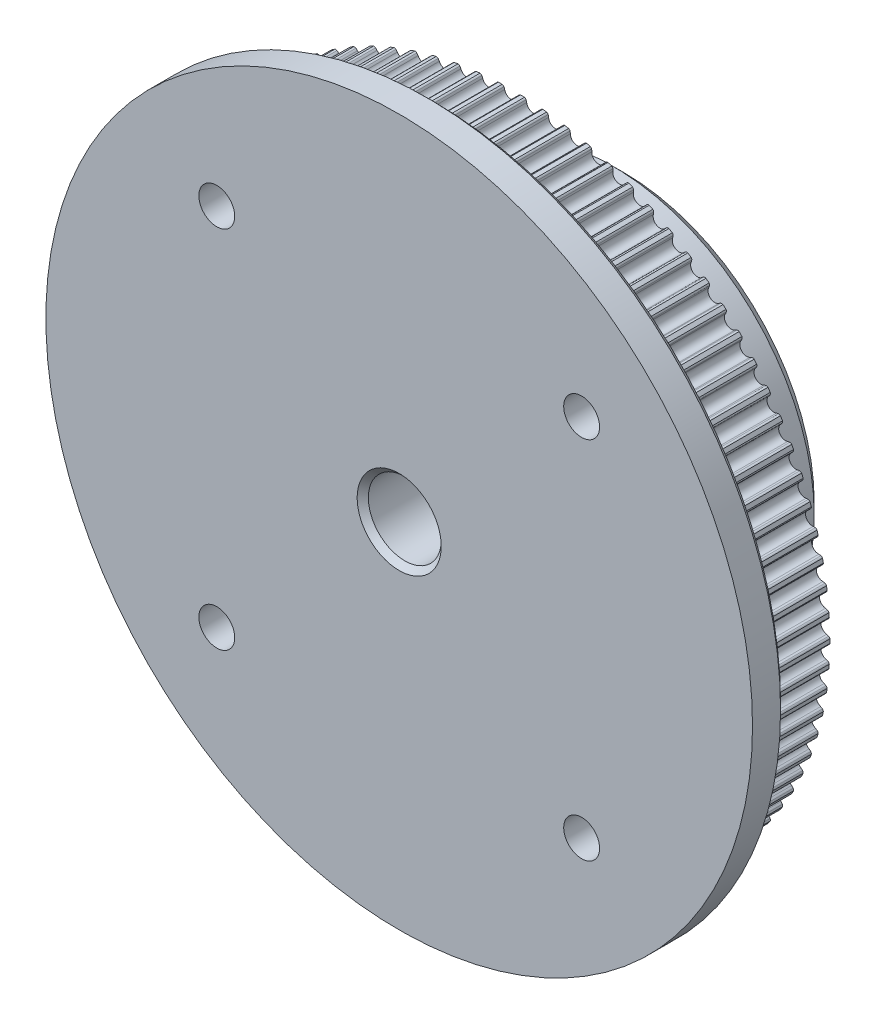
from build123d import *

# Parameters (mm, degrees)
SKETCH_13_R              = 18
EXTRUDE_1_DEPTH          = 10
CHAMFER_1_SIZE           = 1
CHAMFER_2_SIZE           = 1
SKETCH_14_R              = 3.25
CUT_EXTRUDE_4_DEPTH      = 49.831342394
CHAMFER_5_SIZE           = 0.5
CHAMFER_6_SIZE           = 0.5
CUT_EXTRUDE_5_REACH      = 63.988
CUT_EXTRUDE_5_END_RADIUS = 3.25
SKETCH_16_R              = 1.2
SKETCH_17_R              = 1.2
CUT_EXTRUDE_6_DEPTH      = 46.656324863
CUT_EXTRUDE1_START       = -7
CUT_EXTRUDE1_OUTLINE_R   = 29
CUT_EXTRUDE1_DEPTH       = 7
CIRPATTERN1_COUNT        = 4
CHAMFER1_SIZE            = 0.5
SKETCH7_R                = 1.6
CUT_EXTRUDE2_DEPTH       = 46.656324863


# Read off the part's stored shape, not the designer's step: Cut-Extrude1
with BuildPart() as part:
    # Эскиз2 → Повернуть1 (revolve)
    with BuildSketch(Plane(origin=(0, 0, 0), x_dir=(0, 0, -1), z_dir=(1, 0, 0)), mode=Mode.PRIVATE) as revolve_1_sk:
        Polygon((0, 0), (0, 31.5), (3, 31.5), (3, 29), (10, 29), (10, 0), align=None)
    revolve(revolve_1_sk.sketch.rotate(Axis((0, 0, 0), (0, 0, -1)), 90), axis=Axis((0, 0, 0), (0, 0, -1)))

    # Эскиз13 → Бобышка-Вытянуть1 (add)
    with BuildSketch(Plane(origin=(0, 0, -10), x_dir=(-1, 0, 0), z_dir=(0, 0, -1))):
        with Locations(Location((0, 0, 0), (0, 0, 180))):
            Circle(SKETCH_13_R)
    extrude(amount=EXTRUDE_1_DEPTH)

    # Фаска1
    chamfer_1_edges = [part.edges().sort_by_distance(p)[0] for p in [
        (-18, 0, -10),
    ]]
    chamfer(chamfer_1_edges, length=CHAMFER_1_SIZE)

    # Фаска2
    chamfer_2_edges = [part.edges().sort_by_distance(p)[0] for p in [
        (-18, 0, -20),
    ]]
    chamfer(chamfer_2_edges, length=CHAMFER_2_SIZE)

    # Эскиз14 → Вырез-Вытянуть4 (cut, through all)
    with BuildSketch(Plane(origin=(0, 0, -20), x_dir=(-1, 0, 0), z_dir=(0, 0, -1))):
        Circle(SKETCH_14_R)
    extrude(amount=-CUT_EXTRUDE_4_DEPTH, mode=Mode.SUBTRACT)

    # Фаска5
    chamfer_5_edges = [part.edges().sort_by_distance(p)[0] for p in [
        (3.25, 0, 0),
    ]]
    chamfer(chamfer_5_edges, length=CHAMFER_5_SIZE)

    # Фаска6
    chamfer_6_edges = [part.edges().sort_by_distance(p)[0] for p in [
        (3.25, 0, -20),
    ]]
    chamfer(chamfer_6_edges, length=CHAMFER_6_SIZE)

    # Вырез-Вытянуть5: up to this cylinder (the profile starts outside it)
    cut_extrude_5_end = Plane(origin=(0, 0, -16.5), z_dir=(0, 0, -1)) * Cylinder(CUT_EXTRUDE_5_END_RADIUS, 135.476, mode=Mode.PRIVATE)
    # Эскиз16 → Вырез-Вытянуть5 (cut, up to the surface)
    with BuildSketch(Plane(origin=(0, 18, 0), x_dir=(1, 0, 0), z_dir=(0, 1, 0)), mode=Mode.PRIVATE) as cut_extrude_5_sk1:
        with Locations(Location((0, 16.5, 0), (0, 0, 270))):
            Circle(SKETCH_16_R)
    cut_extrude_5_tool1 = extrude(cut_extrude_5_sk1.sketch, amount=-CUT_EXTRUDE_5_REACH, mode=Mode.PRIVATE) - cut_extrude_5_end
    cut_extrude_5 = cut_extrude_5_tool1.solids().sort_by_distance((0, 18, -16.5))[0]
    add(cut_extrude_5, mode=Mode.SUBTRACT)

    # Эскиз17 → Вырез-Вытянуть6 (cut, through all)
    with BuildSketch(Plane(origin=(0, 0, -10), x_dir=(-1, 0, 0), z_dir=(0, 0, -1))):
        with Locations((-16.263455967, 16.263455967)):
            Circle(SKETCH_17_R)
        with Locations((16.263455967, 16.263455967)):
            Circle(SKETCH_17_R)
        with Locations((16.263455967, -16.263455967)):
            Circle(SKETCH_17_R)
        with Locations((-16.263455967, -16.263455967)):
            Circle(SKETCH_17_R)
    extrude(amount=-CUT_EXTRUDE_6_DEPTH, mode=Mode.SUBTRACT)

    # Cut-Extrude1 outline → Cut-Extrude1 (cut)
    with BuildSketch(Plane(origin=(0, 0, -10), x_dir=(-1, 0, 0), z_dir=(0, 0, -1)).offset(CUT_EXTRUDE1_START)):
        Circle(CUT_EXTRUDE1_OUTLINE_R)
        with BuildLine():
            ThreePointArc((0.663199906, 28.275365059), (0.726070477, 28.347977503), (0.813219602, 28.388354547))
            ThreePointArc((0.813219602, 28.388354547), (0.991145706, 28.382699487), (1.169032869, 28.375929274))
            ThreePointArc((1.169032869, 28.375929274), (1.253153143, 28.329571371), (1.310805376, 28.252750177))
            ThreePointArc((1.310805376, 28.252750177), (1.344672476, 28.162535167), (1.365050368, 28.068351995))
            ThreePointArc((1.365050368, 28.068351995), (1.926157607, 27.545337094), (2.554593795, 27.985171015))
            ThreePointArc((2.554593795, 27.985171015), (2.587881134, 28.075601549), (2.633974144, 28.160225204))
            ThreePointArc((2.633974144, 28.160225204), (2.701756753, 28.228275139), (2.791510149, 28.26247461))
            ThreePointArc((2.791510149, 28.26247461), (2.968608357, 28.244421828), (3.145589929, 28.225259326))
            ThreePointArc((3.145589929, 28.225259326), (3.226271527, 28.173146415), (3.278424546, 28.092490737))
            ThreePointArc((3.278424546, 28.092490737), (3.305916067, 28.000133037), (3.319674433, 27.9047578))
            ThreePointArc((3.319674433, 27.9047578), (3.842931168, 27.343876075), (4.50051778, 27.73880109))
            ThreePointArc((4.50051778, 27.73880109), (4.540032148, 27.826689333), (4.591915926, 27.907891562))
            ThreePointArc((4.591915926, 27.907891562), (4.664280343, 27.971047455), (4.756200738, 27.998902738))
            ThreePointArc((4.756200738, 27.998902738), (4.931608246, 27.968540186), (5.106821991, 27.937078751))
            ThreePointArc((5.106821991, 27.937078751), (5.18367184, 27.879464721), (5.230071561, 27.795367506))
            ThreePointArc((5.230071561, 27.795367506), (5.251053567, 27.701317073), (5.258125377, 27.60521443))
            ThreePointArc((5.258125377, 27.60521443), (5.740982353, 27.00919844), (6.424515694, 27.357290514))
            ThreePointArc((6.424515694, 27.357290514), (6.470064581, 27.442208283), (6.527486354, 27.519593478))
            ThreePointArc((6.527486354, 27.519593478), (6.604080028, 27.57754764), (6.697719596, 27.598923026))
            ThreePointArc((6.697719596, 27.598923026), (6.870581835, 27.556398626), (7.043174129, 27.512791537))
            ThreePointArc((7.043174129, 27.512791537), (7.115817825, 27.449957078), (7.156238193, 27.362828038))
            ThreePointArc((7.156238193, 27.362828038), (7.170608461, 27.267543076), (7.170959264, 27.17118123))
            ThreePointArc((7.170959264, 27.17118123), (7.611064051, 26.542934705), (8.317214015, 26.842497969))
            ThreePointArc((8.317214015, 26.842497969), (8.368575511, 26.924031553), (8.431255526, 26.997222701))
            ThreePointArc((8.431255526, 26.997222701), (8.511705299, 27.049692785), (8.606607837, 27.064484136))
            ThreePointArc((8.606607837, 27.064484136), (8.77608264, 27.010005063), (8.945212632, 26.954464769))
            ThreePointArc((8.945212632, 26.954464769), (9.01329626, 26.886716003), (9.047540352, 26.796979622))
            ThreePointArc((9.047540352, 26.796979622), (9.055228872, 26.700924351), (9.048856957, 26.604772767))
            ThreePointArc((9.048856957, 26.604772767), (9.444065409, 25.947356461), (10.169391704, 26.196931472))
            ThreePointArc((10.169391704, 26.196931472), (10.226315582, 26.274683647), (10.293948468, 26.343324169))
            ThreePointArc((10.293948468, 26.343324169), (10.377862398, 26.390054546), (10.47356555, 26.398189799))
            ThreePointArc((10.47356555, 26.398189799), (10.638827253, 26.33202147), (10.803670957, 26.264818557))
            ThreePointArc((10.803670957, 26.264818557), (10.866862822, 26.19248555), (10.894763804, 26.100579016))
            ThreePointArc((10.894763804, 26.100579016), (10.895733118, 26.004221407), (10.88266953, 25.908748525))
            ThreePointArc((10.88266953, 25.908748525), (11.23105623, 25.225365304), (11.972025139, 25.423736159))
            ThreePointArc((11.972025139, 25.423736159), (12.034234071, 25.497328124), (12.106490327, 25.561083609))
            ThreePointArc((12.106490327, 25.561083609), (12.193459593, 25.601846614), (12.289497104, 25.603286135))
            ThreePointArc((12.289497104, 25.603286135), (12.449740569, 25.525750915), (12.609494884, 25.44721279))
            ThreePointArc((12.609494884, 25.44721279), (12.667487121, 25.37064794), (12.688909062, 25.277019012))
            ThreePointArc((12.688909062, 25.277019012), (12.683154447, 25.180828509), (12.66346283, 25.086499464))
            ThreePointArc((12.66346283, 25.086499464), (12.963330475, 24.380478703), (13.716332072, 24.526678958))
            ThreePointArc((13.716332072, 24.526678958), (13.783522981, 24.595752181), (13.860050583, 24.654312019))
            ThreePointArc((13.860050583, 24.654312019), (13.94965148, 24.688909058), (14.045555464, 24.683645835))
            ThreePointArc((14.045555464, 24.683645835), (14.2, 24.595121467), (14.353886619, 24.50563076))
            ThreePointArc((14.353886619, 24.50563076), (14.406396696, 24.425207084), (14.42123523, 24.330311912))
            ThreePointArc((14.42123523, 24.330311912), (14.408784723, 24.234757146), (14.382561012, 24.1420315))
            ThreePointArc((14.382561012, 24.1420315), (14.632448676, 23.41681286), (15.393814413, 23.510130242))
            ThreePointArc((15.393814413, 23.510130242), (15.465659953, 23.574348206), (15.546086065, 23.6274271))
            ThreePointArc((15.546086065, 23.6274271), (15.637882066, 23.655689619), (15.73318529, 23.643749293))
            ThreePointArc((15.73318529, 23.643749293), (15.881078459, 23.544667061), (16.028347661, 23.44465976))
            ThreePointArc((16.028347661, 23.44465976), (16.075119755, 23.360769075), (16.08330259, 23.265069978))
            ThreePointArc((16.08330259, 23.265069978), (16.064216848, 23.170616482), (16.031588803, 23.079945985))
            ThreePointArc((16.031588803, 23.079945985), (16.230279057, 22.339062659), (16.996299638, 22.379042536))
            ThreePointArc((16.996299638, 22.379042536), (17.072449785, 22.438092376), (17.156382579, 22.485431731))
            ThreePointArc((17.156382579, 22.485431731), (17.249926463, 22.507222038), (17.344164618, 22.488662782))
            ThreePointArc((17.344164618, 22.488662782), (17.484785899, 22.379505402), (17.624720205, 22.269468734))
            ThreePointArc((17.624720205, 22.269468734), (17.665526445, 22.182519746), (17.667013716, 22.086482962))
            ThreePointArc((17.667013716, 22.086482962), (17.641385724, 21.993590904), (17.602512304, 21.905417293))
            ThreePointArc((17.602512304, 21.905417293), (17.749037151, 21.15247879), (18.515980599, 21.138926384))
            ThreePointArc((18.515980599, 21.138926384), (18.596064357, 21.192520416), (18.683094922, 21.233889598))
            ThreePointArc((18.683094922, 21.233889598), (18.777930953, 21.249101534), (18.870644919, 21.224013766))
            ThreePointArc((18.870644919, 21.224013766), (19.003309221, 21.105313044), (19.135226883, 20.985783095))
            ThreePointArc((19.135226883, 20.985783095), (19.169868467, 20.896199411), (19.164652928, 20.800292822))
            ThreePointArc((19.164652928, 20.800292822), (19.132607541, 20.709414762), (19.087678135, 20.62416761))
            ThreePointArc((19.087678135, 20.62416761), (19.18132372, 19.862842171), (19.945453564, 19.795823507))
            ThreePointArc((19.945453564, 19.795823507), (20.029080772, 19.843700626), (20.118785104, 19.87889809))
            ThreePointArc((20.118785104, 19.87889809), (20.21445125, 19.887457544), (20.305189336, 19.855963488))
            ThreePointArc((20.305189336, 19.855963488), (20.42925033, 19.728297721), (20.55250866, 19.599856831))
            ThreePointArc((20.55250866, 19.599856831), (20.580816816, 19.508074893), (20.568923877, 19.412765745))
            ThreePointArc((20.568923877, 19.412765745), (20.530617218, 19.324344433), (20.479850717, 19.242439056))
            ThreePointArc((20.479850717, 19.242439056), (20.520160808, 18.476435781), (21.277754285, 18.356277368))
            ThreePointArc((21.277754285, 18.356277368), (21.36451752, 18.398204322), (21.456458587, 18.427058588))
            ThreePointArc((21.456458587, 18.427058588), (21.552488773, 18.428923859), (21.640808911, 18.391176952))
            ThreePointArc((21.640808911, 18.391176952), (21.755662185, 18.255168115), (21.86966068, 18.118442034))
            ThreePointArc((21.86966068, 18.118442034), (21.891497495, 18.024908996), (21.872985096, 17.930661625))
            ThreePointArc((21.872985096, 17.930661625), (21.828603791, 17.84512784), (21.772247525, 17.766963272))
            ThreePointArc((21.772247525, 17.766963272), (21.759025735, 17.000014053), (22.506391925, 16.827301291))
            ThreePointArc((22.506391925, 16.827301291), (22.595868486, 16.863073815), (22.689598361, 16.88544431))
            ThreePointArc((22.689598361, 16.88544431), (22.785524736, 16.880606309), (22.87099664, 16.836790451))
            ThreePointArc((22.87099664, 16.836790451), (22.97608264, 16.693101165), (23.080265912, 16.548756009))
            ThreePointArc((23.080265912, 16.548756009), (23.095524999, 16.453927553), (23.07048333, 16.361201124))
            ThreePointArc((23.07048333, 16.361201124), (23.020243601, 16.278971579), (22.958572131, 16.20492863))
            ThreePointArc((22.958572131, 16.20492863), (22.891882876, 15.440769966), (23.625380686, 15.216344293))
            ThreePointArc((23.625380686, 15.216344293), (23.717134652, 15.245788108), (23.812196692, 15.261565844))
            ThreePointArc((23.812196692, 15.261565844), (23.907551914, 15.250048143), (23.989759173, 15.200376799))
            ThreePointArc((23.989759173, 15.200376799), (24.084565931, 15.049707104), (24.178426408, 14.898446108))
            ThreePointArc((24.178426408, 14.898446108), (24.187033426, 14.802784229), (24.155584489, 14.712030495))
            ThreePointArc((24.155584489, 14.712030495), (24.099731098, 14.633505804), (24.033044882, 14.563945204))
            ThreePointArc((24.033044882, 14.563945204), (23.913213065, 13.8063), (24.629268967, 13.531254796))
            ThreePointArc((24.629268967, 13.531254796), (24.722853322, 13.554226454), (24.818784395, 13.563334563))
            ThreePointArc((24.818784395, 13.563334563), (24.913103902, 13.545193274), (24.99164601, 13.489908439))
            ThreePointArc((24.99164601, 13.489908439), (25.075711637, 13.332992383), (25.158792041, 13.175552475))
            ThreePointArc((25.158792041, 13.175552475), (25.160705057, 13.079523228), (25.123002068, 12.991184333))
            ThreePointArc((25.123002068, 12.991184333), (25.061807128, 12.916747059), (24.990431054, 12.852007701))
            ThreePointArc((24.990431054, 12.852007701), (24.818040483, 12.104567128), (25.513165926, 11.780242385))
            ThreePointArc((25.513165926, 11.780242385), (25.608124735, 11.796629971), (25.704457475, 11.79902408))
            ThreePointArc((25.704457475, 11.79902408), (25.797281752, 11.774347586), (25.87177606, 11.713718602))
            ThreePointArc((25.87177606, 11.713718602), (25.944690997, 11.551320664), (26.016586569, 11.388468875))
            ThreePointArc((26.016586569, 11.388468875), (26.011796263, 11.292540106), (25.968022907, 11.207046427))
            ThreePointArc((25.968022907, 11.207046427), (25.901784553, 11.137059222), (25.826066357, 11.077456509))
            ThreePointArc((25.826066357, 11.077456509), (25.601956903, 10.343862022), (26.272765304, 9.971837818))
            ThreePointArc((26.272765304, 9.971837818), (26.368635939, 9.981561492), (26.464901022, 9.977229937))
            ThreePointArc((26.464901022, 9.977229937), (26.555777838, 9.94613846), (26.625861418, 9.880460704))
            ThreePointArc((26.625861418, 9.880460704), (26.68727043, 9.71337207), (26.747630902, 9.545901799))
            ThreePointArc((26.747630902, 9.545901799), (26.736160612, 9.450540862), (26.686530148, 9.368308917))
            ThreePointArc((26.686530148, 9.368308917), (26.615571087, 9.303112751), (26.535879662, 9.248937062))
            ThreePointArc((26.535879662, 9.248937062), (26.261143162, 8.532762659), (26.904366411, 8.114851459))
            ThreePointArc((26.904366411, 8.114851459), (27.000681799, 8.11786385), (27.096410231, 8.106827733))
            ThreePointArc((27.096410231, 8.106827733), (27.184896845, 8.069472747), (27.250228256, 7.999066196))
            ThreePointArc((27.250228256, 7.999066196), (27.299832165, 7.828100905), (27.348363465, 7.656828049))
            ThreePointArc((27.348363465, 7.656828049), (27.330269074, 7.562499534), (27.275023297, 7.483929948))
            ThreePointArc((27.275023297, 7.483929948), (27.199689233, 7.42384245), (27.116412828, 7.375357723))
            ThreePointArc((27.116412828, 7.375357723), (26.792387771, 6.680092534), (27.40489215, 6.218330359))
            ThreePointArc((27.40489215, 6.218330359), (27.501183053, 6.21461679), (27.595908454, 6.196929879))
            ThreePointArc((27.595908454, 6.196929879), (27.681573766, 6.153493374), (27.74183472, 6.078701041))
            ThreePointArc((27.74183472, 6.078701041), (27.779391861, 5.90469202), (27.815857551, 5.730451003))
            ThreePointArc((27.815857551, 5.730451003), (27.791227213, 5.637614468), (27.730635274, 5.563090024))
            ThreePointArc((27.730635274, 5.563090024), (27.651293229, 5.508403935), (27.564837557, 5.465846383))
            ThreePointArc((27.564837557, 5.465846383), (27.193102561, 4.794877671), (27.771904008, 4.291514179))
            ThreePointArc((27.771904008, 4.291514179), (27.867701305, 4.281092743), (27.960962184, 4.256841206))
            ThreePointArc((27.960962184, 4.256841206), (28.043388843, 4.2075348), (28.098285755, 4.128721065))
            ThreePointArc((28.098285755, 4.128721065), (28.123613152, 3.952516067), (28.147835575, 3.776155775))
            ThreePointArc((28.147835575, 3.776155775), (28.116789286, 3.685263511), (28.051146383, 3.615147285))
            ThreePointArc((28.051146383, 3.615147285), (27.968182902, 3.56612903), (27.878969167, 3.529705989))
            ThreePointArc((27.878969167, 3.529705989), (27.461335288, 2.886302645), (28.003613942, 2.343790174))
            ThreePointArc((28.003613942, 2.343790174), (28.098450919, 2.326711642), (28.189792917, 2.296013631))
            ThreePointArc((28.189792917, 2.296013631), (28.268579348, 2.241077539), (28.317844766, 2.158626376))
            ThreePointArc((28.317844766, 2.158626376), (28.330819027, 1.981083854), (28.342680173, 1.803463496))
            ThreePointArc((28.342680173, 1.803463496), (28.305369187, 1.714958321), (28.234995127, 1.649591912))
            ThreePointArc((28.234995127, 1.649591912), (28.148814401, 1.606480303), (28.057277243, 1.576369222))
            ThreePointArc((28.057277243, 1.576369222), (27.59577915, 0.963665843), (28.098893084, 0.384647458))
            ThreePointArc((28.098893084, 0.384647458), (28.192307705, 0.360995035), (28.281285813, 0.324000107))
            ThreePointArc((28.281285813, 0.324000107), (28.356048176, 0.263701974), (28.399442083, 0.178015075))
            ThreePointArc((28.399442083, 0.178015075), (28.4, 0), (28.399442083, -0.178015075))
            ThreePointArc((28.399442083, -0.178015075), (28.356048176, -0.263701974), (28.281285813, -0.324000107))
            ThreePointArc((28.281285813, -0.324000107), (28.192307705, -0.360995035), (28.098893084, -0.384647458))
            ThreePointArc((28.098893084, -0.384647458), (27.59577915, -0.963665843), (28.057277243, -1.576369222))
            ThreePointArc((28.057277243, -1.576369222), (28.148814401, -1.606480303), (28.234995127, -1.649591912))
            ThreePointArc((28.234995127, -1.649591912), (28.305369187, -1.714958321), (28.342680173, -1.803463497))
            ThreePointArc((28.342680173, -1.803463497), (28.330819027, -1.981083855), (28.317844766, -2.158626376))
            ThreePointArc((28.317844766, -2.158626376), (28.268579348, -2.241077539), (28.189792917, -2.296013631))
            ThreePointArc((28.189792917, -2.296013631), (28.098450919, -2.326711642), (28.003613942, -2.343790174))
            ThreePointArc((28.003613942, -2.343790174), (27.461335288, -2.886302645), (27.878969167, -3.529705989))
            ThreePointArc((27.878969167, -3.529705989), (27.968182902, -3.56612903), (28.051146383, -3.615147285))
            ThreePointArc((28.051146383, -3.615147285), (28.116789286, -3.685263511), (28.147835575, -3.776155775))
            ThreePointArc((28.147835575, -3.776155775), (28.123613152, -3.952516067), (28.098285755, -4.128721065))
            ThreePointArc((28.098285755, -4.128721065), (28.043388843, -4.2075348), (27.960962184, -4.256841206))
            ThreePointArc((27.960962184, -4.256841206), (27.867701305, -4.281092743), (27.771904008, -4.291514179))
            ThreePointArc((27.771904008, -4.291514179), (27.193102561, -4.794877671), (27.564837557, -5.465846383))
            ThreePointArc((27.564837557, -5.465846383), (27.651293229, -5.508403935), (27.730635274, -5.563090024))
            ThreePointArc((27.730635274, -5.563090024), (27.791227213, -5.637614468), (27.815857551, -5.730451003))
            ThreePointArc((27.815857551, -5.730451003), (27.779391861, -5.90469202), (27.74183472, -6.078701041))
            ThreePointArc((27.74183472, -6.078701041), (27.681573766, -6.153493374), (27.595908454, -6.196929879))
            ThreePointArc((27.595908454, -6.196929879), (27.501183053, -6.21461679), (27.40489215, -6.218330359))
            ThreePointArc((27.40489215, -6.218330359), (26.792387771, -6.680092534), (27.116412828, -7.375357723))
            ThreePointArc((27.116412828, -7.375357723), (27.199689233, -7.42384245), (27.275023297, -7.483929948))
            ThreePointArc((27.275023297, -7.483929948), (27.330269074, -7.562499534), (27.348363465, -7.656828049))
            ThreePointArc((27.348363465, -7.656828049), (27.299832165, -7.828100905), (27.250228256, -7.999066196))
            ThreePointArc((27.250228256, -7.999066196), (27.184896845, -8.069472747), (27.096410231, -8.106827733))
            ThreePointArc((27.096410231, -8.106827733), (27.000681799, -8.11786385), (26.904366411, -8.114851459))
            ThreePointArc((26.904366411, -8.114851459), (26.261143162, -8.532762659), (26.535879662, -9.248937062))
            ThreePointArc((26.535879662, -9.248937062), (26.615571087, -9.303112751), (26.686530148, -9.368308917))
            ThreePointArc((26.686530148, -9.368308917), (26.736160612, -9.450540862), (26.747630902, -9.545901799))
            ThreePointArc((26.747630902, -9.545901799), (26.68727043, -9.71337207), (26.625861418, -9.880460704))
            ThreePointArc((26.625861418, -9.880460704), (26.555777838, -9.94613846), (26.464901022, -9.977229937))
            ThreePointArc((26.464901022, -9.977229937), (26.368635939, -9.981561492), (26.272765304, -9.971837818))
            ThreePointArc((26.272765304, -9.971837818), (25.601956903, -10.343862022), (25.826066357, -11.077456509))
            ThreePointArc((25.826066357, -11.077456509), (25.901784553, -11.137059222), (25.968022907, -11.207046427))
            ThreePointArc((25.968022907, -11.207046427), (26.011796263, -11.292540106), (26.016586569, -11.388468875))
            ThreePointArc((26.016586569, -11.388468875), (25.944690997, -11.551320664), (25.87177606, -11.713718602))
            ThreePointArc((25.87177606, -11.713718602), (25.797281752, -11.774347586), (25.704457475, -11.79902408))
            ThreePointArc((25.704457475, -11.79902408), (25.608124735, -11.796629971), (25.513165926, -11.780242385))
            ThreePointArc((25.513165926, -11.780242385), (24.818040483, -12.104567128), (24.990431054, -12.852007701))
            ThreePointArc((24.990431054, -12.852007701), (25.061807128, -12.916747059), (25.123002068, -12.991184333))
            ThreePointArc((25.123002068, -12.991184333), (25.160705057, -13.079523228), (25.158792041, -13.175552475))
            ThreePointArc((25.158792041, -13.175552475), (25.075711637, -13.332992383), (24.99164601, -13.489908439))
            ThreePointArc((24.99164601, -13.489908439), (24.913103902, -13.545193274), (24.818784395, -13.563334563))
            ThreePointArc((24.818784395, -13.563334563), (24.722853322, -13.554226454), (24.629268967, -13.531254796))
            ThreePointArc((24.629268967, -13.531254796), (23.913213065, -13.8063), (24.033044882, -14.563945204))
            ThreePointArc((24.033044882, -14.563945204), (24.099731098, -14.633505804), (24.155584489, -14.712030495))
            ThreePointArc((24.155584489, -14.712030495), (24.187033426, -14.802784229), (24.178426408, -14.898446108))
            ThreePointArc((24.178426408, -14.898446108), (24.084565931, -15.049707104), (23.989759173, -15.200376799))
            ThreePointArc((23.989759173, -15.200376799), (23.907551914, -15.250048143), (23.812196692, -15.261565844))
            ThreePointArc((23.812196692, -15.261565844), (23.717134652, -15.245788108), (23.625380686, -15.216344293))
            ThreePointArc((23.625380686, -15.216344293), (22.891882876, -15.440769966), (22.958572131, -16.20492863))
            ThreePointArc((22.958572131, -16.20492863), (23.020243601, -16.278971579), (23.07048333, -16.361201124))
            ThreePointArc((23.07048333, -16.361201124), (23.095524999, -16.453927553), (23.080265912, -16.548756009))
            ThreePointArc((23.080265912, -16.548756009), (22.97608264, -16.693101165), (22.87099664, -16.836790451))
            ThreePointArc((22.87099664, -16.836790451), (22.785524736, -16.880606309), (22.689598361, -16.88544431))
            ThreePointArc((22.689598361, -16.88544431), (22.595868486, -16.863073815), (22.506391925, -16.827301291))
            ThreePointArc((22.506391925, -16.827301291), (21.759025735, -17.000014053), (21.772247525, -17.766963272))
            ThreePointArc((21.772247525, -17.766963272), (21.828603791, -17.84512784), (21.872985096, -17.930661625))
            ThreePointArc((21.872985096, -17.930661625), (21.891497495, -18.024908996), (21.86966068, -18.118442034))
            ThreePointArc((21.86966068, -18.118442034), (21.755662185, -18.255168115), (21.640808911, -18.391176952))
            ThreePointArc((21.640808911, -18.391176952), (21.552488773, -18.428923859), (21.456458587, -18.427058588))
            ThreePointArc((21.456458587, -18.427058588), (21.36451752, -18.398204322), (21.277754285, -18.356277368))
            ThreePointArc((21.277754285, -18.356277368), (20.520160808, -18.476435781), (20.479850717, -19.242439056))
            ThreePointArc((20.479850717, -19.242439056), (20.530617218, -19.324344433), (20.568923877, -19.412765745))
            ThreePointArc((20.568923877, -19.412765745), (20.580816816, -19.508074893), (20.55250866, -19.599856831))
            ThreePointArc((20.55250866, -19.599856831), (20.42925033, -19.728297721), (20.305189336, -19.855963488))
            ThreePointArc((20.305189336, -19.855963488), (20.21445125, -19.887457544), (20.118785104, -19.87889809))
            ThreePointArc((20.118785104, -19.87889809), (20.029080772, -19.843700626), (19.945453564, -19.795823507))
            ThreePointArc((19.945453564, -19.795823507), (19.18132372, -19.862842171), (19.087678135, -20.62416761))
            ThreePointArc((19.087678135, -20.62416761), (19.132607541, -20.709414762), (19.164652928, -20.800292822))
            ThreePointArc((19.164652928, -20.800292822), (19.169868467, -20.896199411), (19.135226883, -20.985783095))
            ThreePointArc((19.135226883, -20.985783095), (19.003309221, -21.105313044), (18.870644919, -21.224013766))
            ThreePointArc((18.870644919, -21.224013766), (18.777930953, -21.249101534), (18.683094922, -21.233889598))
            ThreePointArc((18.683094922, -21.233889598), (18.596064357, -21.192520416), (18.515980599, -21.138926384))
            ThreePointArc((18.515980599, -21.138926384), (17.749037151, -21.15247879), (17.602512304, -21.905417293))
            ThreePointArc((17.602512304, -21.905417293), (17.641385724, -21.993590904), (17.667013716, -22.086482962))
            ThreePointArc((17.667013716, -22.086482962), (17.665526445, -22.182519746), (17.624720205, -22.269468734))
            ThreePointArc((17.624720205, -22.269468734), (17.484785899, -22.379505402), (17.344164618, -22.488662782))
            ThreePointArc((17.344164618, -22.488662782), (17.249926463, -22.507222038), (17.156382579, -22.485431731))
            ThreePointArc((17.156382579, -22.485431731), (17.072449785, -22.438092376), (16.996299638, -22.379042536))
            ThreePointArc((16.996299638, -22.379042536), (16.230279057, -22.339062659), (16.031588803, -23.079945985))
            ThreePointArc((16.031588803, -23.079945985), (16.064216848, -23.170616482), (16.08330259, -23.265069978))
            ThreePointArc((16.08330259, -23.265069978), (16.075119755, -23.360769075), (16.028347661, -23.44465976))
            ThreePointArc((16.028347661, -23.44465976), (15.881078459, -23.544667061), (15.73318529, -23.643749293))
            ThreePointArc((15.73318529, -23.643749293), (15.637882066, -23.655689619), (15.546086065, -23.6274271))
            ThreePointArc((15.546086065, -23.6274271), (15.465659953, -23.574348206), (15.393814413, -23.510130242))
            ThreePointArc((15.393814413, -23.510130242), (14.632448676, -23.41681286), (14.382561012, -24.1420315))
            ThreePointArc((14.382561012, -24.1420315), (14.408784723, -24.234757146), (14.42123523, -24.330311912))
            ThreePointArc((14.42123523, -24.330311912), (14.406396696, -24.425207084), (14.353886619, -24.50563076))
            ThreePointArc((14.353886619, -24.50563076), (14.2, -24.595121467), (14.045555464, -24.683645835))
            ThreePointArc((14.045555464, -24.683645835), (13.94965148, -24.688909058), (13.860050583, -24.654312019))
            ThreePointArc((13.860050583, -24.654312019), (13.783522981, -24.595752181), (13.716332072, -24.526678958))
            ThreePointArc((13.716332072, -24.526678958), (12.963330475, -24.380478703), (12.66346283, -25.086499464))
            ThreePointArc((12.66346283, -25.086499464), (12.683154447, -25.180828509), (12.688909062, -25.277019012))
            ThreePointArc((12.688909062, -25.277019012), (12.667487121, -25.37064794), (12.609494884, -25.44721279))
            ThreePointArc((12.609494884, -25.44721279), (12.449740569, -25.525750915), (12.289497104, -25.603286135))
            ThreePointArc((12.289497104, -25.603286135), (12.193459593, -25.601846614), (12.106490327, -25.561083609))
            ThreePointArc((12.106490327, -25.561083609), (12.034234071, -25.497328124), (11.972025139, -25.423736159))
            ThreePointArc((11.972025139, -25.423736159), (11.23105623, -25.225365304), (10.88266953, -25.908748525))
            ThreePointArc((10.88266953, -25.908748525), (10.895733118, -26.004221407), (10.894763804, -26.100579016))
            ThreePointArc((10.894763804, -26.100579016), (10.866862822, -26.19248555), (10.803670957, -26.264818557))
            ThreePointArc((10.803670957, -26.264818557), (10.638827253, -26.33202147), (10.47356555, -26.398189799))
            ThreePointArc((10.47356555, -26.398189799), (10.377862398, -26.390054546), (10.293948468, -26.343324169))
            ThreePointArc((10.293948468, -26.343324169), (10.226315582, -26.274683647), (10.169391704, -26.196931472))
            ThreePointArc((10.169391704, -26.196931472), (9.444065409, -25.947356461), (9.048856957, -26.604772767))
            ThreePointArc((9.048856957, -26.604772767), (9.055228872, -26.700924351), (9.047540352, -26.796979622))
            ThreePointArc((9.047540352, -26.796979622), (9.01329626, -26.886716003), (8.945212632, -26.954464769))
            ThreePointArc((8.945212632, -26.954464769), (8.77608264, -27.010005063), (8.606607837, -27.064484136))
            ThreePointArc((8.606607837, -27.064484136), (8.511705299, -27.049692785), (8.431255526, -26.997222701))
            ThreePointArc((8.431255526, -26.997222701), (8.368575511, -26.924031553), (8.317214015, -26.842497969))
            ThreePointArc((8.317214015, -26.842497969), (7.611064051, -26.542934705), (7.170959264, -27.17118123))
            ThreePointArc((7.170959264, -27.17118123), (7.170608461, -27.267543076), (7.156238193, -27.362828038))
            ThreePointArc((7.156238193, -27.362828038), (7.115817825, -27.449957078), (7.043174129, -27.512791537))
            ThreePointArc((7.043174129, -27.512791537), (6.870581835, -27.556398626), (6.697719596, -27.598923026))
            ThreePointArc((6.697719596, -27.598923026), (6.604080028, -27.57754764), (6.527486354, -27.519593478))
            ThreePointArc((6.527486354, -27.519593478), (6.470064581, -27.442208283), (6.424515694, -27.357290514))
            ThreePointArc((6.424515694, -27.357290514), (5.740982353, -27.00919844), (5.258125377, -27.60521443))
            ThreePointArc((5.258125377, -27.60521443), (5.251053567, -27.701317073), (5.230071561, -27.795367506))
            ThreePointArc((5.230071561, -27.795367506), (5.18367184, -27.879464721), (5.106821991, -27.937078751))
            ThreePointArc((5.106821991, -27.937078751), (4.931608246, -27.968540186), (4.756200738, -27.998902738))
            ThreePointArc((4.756200738, -27.998902738), (4.664280343, -27.971047455), (4.591915926, -27.907891562))
            ThreePointArc((4.591915926, -27.907891562), (4.540032148, -27.826689333), (4.50051778, -27.73880109))
            ThreePointArc((4.50051778, -27.73880109), (3.842931168, -27.343876075), (3.319674433, -27.9047578))
            ThreePointArc((3.319674433, -27.9047578), (3.305916067, -28.000133037), (3.278424546, -28.092490737))
            ThreePointArc((3.278424546, -28.092490737), (3.226271527, -28.173146415), (3.145589929, -28.225259326))
            ThreePointArc((3.145589929, -28.225259326), (2.968608357, -28.244421828), (2.791510149, -28.26247461))
            ThreePointArc((2.791510149, -28.26247461), (2.701756753, -28.228275139), (2.633974144, -28.160225204))
            ThreePointArc((2.633974144, -28.160225204), (2.587881134, -28.075601549), (2.554593795, -27.985171015))
            ThreePointArc((2.554593795, -27.985171015), (1.926157607, -27.545337094), (1.365050368, -28.068351995))
            ThreePointArc((1.365050368, -28.068351995), (1.344672476, -28.162535167), (1.310805376, -28.252750177))
            ThreePointArc((1.310805376, -28.252750177), (1.253153143, -28.329571371), (1.169032869, -28.375929274))
            ThreePointArc((1.169032869, -28.375929274), (0.991145706, -28.382699487), (0.813219602, -28.388354547))
            ThreePointArc((0.813219602, -28.388354547), (0.726070477, -28.347977503), (0.663199906, -28.275365059))
            ThreePointArc((0.663199906, -28.275365059), (0.623122223, -28.187732258), (0.596224085, -28.0952))
            ThreePointArc((0.596224085, -28.0952), (0, -27.6126), (-0.596224085, -28.0952))
            ThreePointArc((-0.596224085, -28.0952), (-0.623122223, -28.187732258), (-0.663199906, -28.275365059))
            ThreePointArc((-0.663199906, -28.275365059), (-0.726070477, -28.347977503), (-0.813219602, -28.388354547))
            ThreePointArc((-0.813219602, -28.388354547), (-0.991145706, -28.382699487), (-1.169032869, -28.375929274))
            ThreePointArc((-1.169032869, -28.375929274), (-1.253153143, -28.329571371), (-1.310805376, -28.252750177))
            ThreePointArc((-1.310805376, -28.252750177), (-1.344672476, -28.162535167), (-1.365050368, -28.068351995))
            ThreePointArc((-1.365050368, -28.068351995), (-1.926157607, -27.545337094), (-2.554593795, -27.985171015))
            ThreePointArc((-2.554593795, -27.985171015), (-2.587881134, -28.075601549), (-2.633974144, -28.160225204))
            ThreePointArc((-2.633974144, -28.160225204), (-2.701756753, -28.228275139), (-2.791510149, -28.26247461))
            ThreePointArc((-2.791510149, -28.26247461), (-2.968608357, -28.244421828), (-3.145589929, -28.225259326))
            ThreePointArc((-3.145589929, -28.225259326), (-3.226271527, -28.173146415), (-3.278424546, -28.092490737))
            ThreePointArc((-3.278424546, -28.092490737), (-3.305916067, -28.000133037), (-3.319674433, -27.9047578))
            ThreePointArc((-3.319674433, -27.9047578), (-3.842931168, -27.343876075), (-4.50051778, -27.73880109))
            ThreePointArc((-4.50051778, -27.73880109), (-4.540032148, -27.826689333), (-4.591915926, -27.907891562))
            ThreePointArc((-4.591915926, -27.907891562), (-4.664280343, -27.971047455), (-4.756200738, -27.998902738))
            ThreePointArc((-4.756200738, -27.998902738), (-4.931608246, -27.968540186), (-5.106821991, -27.937078751))
            ThreePointArc((-5.106821991, -27.937078751), (-5.18367184, -27.879464721), (-5.230071561, -27.795367506))
            ThreePointArc((-5.230071561, -27.795367506), (-5.251053567, -27.701317073), (-5.258125377, -27.60521443))
            ThreePointArc((-5.258125377, -27.60521443), (-5.740982353, -27.00919844), (-6.424515694, -27.357290514))
            ThreePointArc((-6.424515694, -27.357290514), (-6.470064581, -27.442208283), (-6.527486354, -27.519593478))
            ThreePointArc((-6.527486354, -27.519593478), (-6.604080028, -27.57754764), (-6.697719596, -27.598923026))
            ThreePointArc((-6.697719596, -27.598923026), (-6.870581835, -27.556398626), (-7.043174129, -27.512791537))
            ThreePointArc((-7.043174129, -27.512791537), (-7.115817825, -27.449957078), (-7.156238193, -27.362828038))
            ThreePointArc((-7.156238193, -27.362828038), (-7.170608461, -27.267543076), (-7.170959264, -27.17118123))
            ThreePointArc((-7.170959264, -27.17118123), (-7.611064051, -26.542934705), (-8.317214015, -26.842497969))
            ThreePointArc((-8.317214015, -26.842497969), (-8.368575511, -26.924031553), (-8.431255526, -26.997222701))
            ThreePointArc((-8.431255526, -26.997222701), (-8.511705299, -27.049692785), (-8.606607837, -27.064484136))
            ThreePointArc((-8.606607837, -27.064484136), (-8.77608264, -27.010005063), (-8.945212632, -26.954464769))
            ThreePointArc((-8.945212632, -26.954464769), (-9.01329626, -26.886716003), (-9.047540352, -26.796979622))
            ThreePointArc((-9.047540352, -26.796979622), (-9.055228872, -26.700924351), (-9.048856957, -26.604772767))
            ThreePointArc((-9.048856957, -26.604772767), (-9.444065409, -25.947356461), (-10.169391704, -26.196931472))
            ThreePointArc((-10.169391704, -26.196931472), (-10.226315582, -26.274683647), (-10.293948468, -26.343324169))
            ThreePointArc((-10.293948468, -26.343324169), (-10.377862398, -26.390054546), (-10.47356555, -26.398189799))
            ThreePointArc((-10.47356555, -26.398189799), (-10.638827253, -26.33202147), (-10.803670957, -26.264818557))
            ThreePointArc((-10.803670957, -26.264818557), (-10.866862822, -26.19248555), (-10.894763804, -26.100579016))
            ThreePointArc((-10.894763804, -26.100579016), (-10.895733118, -26.004221407), (-10.88266953, -25.908748525))
            ThreePointArc((-10.88266953, -25.908748525), (-11.23105623, -25.225365304), (-11.972025139, -25.423736159))
            ThreePointArc((-11.972025139, -25.423736159), (-12.034234071, -25.497328124), (-12.106490327, -25.561083609))
            ThreePointArc((-12.106490327, -25.561083609), (-12.193459593, -25.601846614), (-12.289497104, -25.603286135))
            ThreePointArc((-12.289497104, -25.603286135), (-12.449740569, -25.525750915), (-12.609494884, -25.44721279))
            ThreePointArc((-12.609494884, -25.44721279), (-12.667487121, -25.37064794), (-12.688909062, -25.277019012))
            ThreePointArc((-12.688909062, -25.277019012), (-12.683154447, -25.180828509), (-12.66346283, -25.086499464))
            ThreePointArc((-12.66346283, -25.086499464), (-12.963330475, -24.380478703), (-13.716332072, -24.526678958))
            ThreePointArc((-13.716332072, -24.526678958), (-13.783522981, -24.595752181), (-13.860050583, -24.654312019))
            ThreePointArc((-13.860050583, -24.654312019), (-13.94965148, -24.688909058), (-14.045555464, -24.683645835))
            ThreePointArc((-14.045555464, -24.683645835), (-14.2, -24.595121467), (-14.353886619, -24.50563076))
            ThreePointArc((-14.353886619, -24.50563076), (-14.406396696, -24.425207084), (-14.42123523, -24.330311912))
            ThreePointArc((-14.42123523, -24.330311912), (-14.408784723, -24.234757146), (-14.382561012, -24.1420315))
            ThreePointArc((-14.382561012, -24.1420315), (-14.632448676, -23.41681286), (-15.393814413, -23.510130242))
            ThreePointArc((-15.393814413, -23.510130242), (-15.465659953, -23.574348206), (-15.546086065, -23.6274271))
            ThreePointArc((-15.546086065, -23.6274271), (-15.637882066, -23.655689619), (-15.73318529, -23.643749293))
            ThreePointArc((-15.73318529, -23.643749293), (-15.881078459, -23.544667061), (-16.028347661, -23.44465976))
            ThreePointArc((-16.028347661, -23.44465976), (-16.075119755, -23.360769075), (-16.08330259, -23.265069978))
            ThreePointArc((-16.08330259, -23.265069978), (-16.064216848, -23.170616482), (-16.031588803, -23.079945985))
            ThreePointArc((-16.031588803, -23.079945985), (-16.230279057, -22.339062659), (-16.996299638, -22.379042536))
            ThreePointArc((-16.996299638, -22.379042536), (-17.072449785, -22.438092376), (-17.156382579, -22.485431731))
            ThreePointArc((-17.156382579, -22.485431731), (-17.249926463, -22.507222038), (-17.344164618, -22.488662782))
            ThreePointArc((-17.344164618, -22.488662782), (-17.484785899, -22.379505402), (-17.624720205, -22.269468734))
            ThreePointArc((-17.624720205, -22.269468734), (-17.665526445, -22.182519746), (-17.667013716, -22.086482962))
            ThreePointArc((-17.667013716, -22.086482962), (-17.641385724, -21.993590904), (-17.602512304, -21.905417293))
            ThreePointArc((-17.602512304, -21.905417293), (-17.749037151, -21.15247879), (-18.515980599, -21.138926384))
            ThreePointArc((-18.515980599, -21.138926384), (-18.596064357, -21.192520416), (-18.683094922, -21.233889598))
            ThreePointArc((-18.683094922, -21.233889598), (-18.777930953, -21.249101534), (-18.870644919, -21.224013766))
            ThreePointArc((-18.870644919, -21.224013766), (-19.003309221, -21.105313044), (-19.135226883, -20.985783095))
            ThreePointArc((-19.135226883, -20.985783095), (-19.169868467, -20.896199411), (-19.164652928, -20.800292822))
            ThreePointArc((-19.164652928, -20.800292822), (-19.132607541, -20.709414762), (-19.087678135, -20.62416761))
            ThreePointArc((-19.087678135, -20.62416761), (-19.18132372, -19.862842171), (-19.945453564, -19.795823507))
            ThreePointArc((-19.945453564, -19.795823507), (-20.029080772, -19.843700626), (-20.118785104, -19.87889809))
            ThreePointArc((-20.118785104, -19.87889809), (-20.21445125, -19.887457544), (-20.305189336, -19.855963488))
            ThreePointArc((-20.305189336, -19.855963488), (-20.42925033, -19.728297721), (-20.55250866, -19.599856831))
            ThreePointArc((-20.55250866, -19.599856831), (-20.580816816, -19.508074893), (-20.568923877, -19.412765745))
            ThreePointArc((-20.568923877, -19.412765745), (-20.530617218, -19.324344433), (-20.479850717, -19.242439056))
            ThreePointArc((-20.479850717, -19.242439056), (-20.520160808, -18.476435781), (-21.277754285, -18.356277368))
            ThreePointArc((-21.277754285, -18.356277368), (-21.36451752, -18.398204322), (-21.456458587, -18.427058588))
            ThreePointArc((-21.456458587, -18.427058588), (-21.552488773, -18.428923859), (-21.640808911, -18.391176952))
            ThreePointArc((-21.640808911, -18.391176952), (-21.755662185, -18.255168115), (-21.86966068, -18.118442034))
            ThreePointArc((-21.86966068, -18.118442034), (-21.891497495, -18.024908996), (-21.872985096, -17.930661625))
            ThreePointArc((-21.872985096, -17.930661625), (-21.828603791, -17.84512784), (-21.772247525, -17.766963272))
            ThreePointArc((-21.772247525, -17.766963272), (-21.759025735, -17.000014053), (-22.506391925, -16.827301291))
            ThreePointArc((-22.506391925, -16.827301291), (-22.595868486, -16.863073815), (-22.689598361, -16.88544431))
            ThreePointArc((-22.689598361, -16.88544431), (-22.785524736, -16.880606309), (-22.87099664, -16.836790451))
            ThreePointArc((-22.87099664, -16.836790451), (-22.97608264, -16.693101165), (-23.080265912, -16.548756009))
            ThreePointArc((-23.080265912, -16.548756009), (-23.095524999, -16.453927553), (-23.07048333, -16.361201124))
            ThreePointArc((-23.07048333, -16.361201124), (-23.020243601, -16.278971579), (-22.958572131, -16.20492863))
            ThreePointArc((-22.958572131, -16.20492863), (-22.891882876, -15.440769966), (-23.625380686, -15.216344293))
            ThreePointArc((-23.625380686, -15.216344293), (-23.717134652, -15.245788108), (-23.812196692, -15.261565844))
            ThreePointArc((-23.812196692, -15.261565844), (-23.907551914, -15.250048143), (-23.989759173, -15.200376799))
            ThreePointArc((-23.989759173, -15.200376799), (-24.084565931, -15.049707104), (-24.178426408, -14.898446108))
            ThreePointArc((-24.178426408, -14.898446108), (-24.187033426, -14.802784229), (-24.155584489, -14.712030495))
            ThreePointArc((-24.155584489, -14.712030495), (-24.099731098, -14.633505804), (-24.033044882, -14.563945204))
            ThreePointArc((-24.033044882, -14.563945204), (-23.913213065, -13.8063), (-24.629268967, -13.531254796))
            ThreePointArc((-24.629268967, -13.531254796), (-24.722853322, -13.554226454), (-24.818784395, -13.563334563))
            ThreePointArc((-24.818784395, -13.563334563), (-24.913103902, -13.545193274), (-24.99164601, -13.489908439))
            ThreePointArc((-24.99164601, -13.489908439), (-25.075711637, -13.332992383), (-25.158792041, -13.175552475))
            ThreePointArc((-25.158792041, -13.175552475), (-25.160705057, -13.079523228), (-25.123002068, -12.991184333))
            ThreePointArc((-25.123002068, -12.991184333), (-25.061807128, -12.916747059), (-24.990431054, -12.852007701))
            ThreePointArc((-24.990431054, -12.852007701), (-24.818040483, -12.104567128), (-25.513165926, -11.780242385))
            ThreePointArc((-25.513165926, -11.780242385), (-25.608124735, -11.796629971), (-25.704457475, -11.79902408))
            ThreePointArc((-25.704457475, -11.79902408), (-25.797281752, -11.774347586), (-25.87177606, -11.713718602))
            ThreePointArc((-25.87177606, -11.713718602), (-25.944690997, -11.551320664), (-26.016586569, -11.388468875))
            ThreePointArc((-26.016586569, -11.388468875), (-26.011796263, -11.292540106), (-25.968022907, -11.207046427))
            ThreePointArc((-25.968022907, -11.207046427), (-25.901784553, -11.137059222), (-25.826066357, -11.077456509))
            ThreePointArc((-25.826066357, -11.077456509), (-25.601956903, -10.343862022), (-26.272765304, -9.971837818))
            ThreePointArc((-26.272765304, -9.971837818), (-26.368635939, -9.981561492), (-26.464901022, -9.977229937))
            ThreePointArc((-26.464901022, -9.977229937), (-26.555777838, -9.94613846), (-26.625861418, -9.880460704))
            ThreePointArc((-26.625861418, -9.880460704), (-26.68727043, -9.71337207), (-26.747630902, -9.545901799))
            ThreePointArc((-26.747630902, -9.545901799), (-26.736160612, -9.450540862), (-26.686530148, -9.368308917))
            ThreePointArc((-26.686530148, -9.368308917), (-26.615571087, -9.303112751), (-26.535879662, -9.248937062))
            ThreePointArc((-26.535879662, -9.248937062), (-26.261143162, -8.532762659), (-26.904366411, -8.114851459))
            ThreePointArc((-26.904366411, -8.114851459), (-27.000681799, -8.11786385), (-27.096410231, -8.106827733))
            ThreePointArc((-27.096410231, -8.106827733), (-27.184896845, -8.069472747), (-27.250228256, -7.999066196))
            ThreePointArc((-27.250228256, -7.999066196), (-27.299832165, -7.828100905), (-27.348363465, -7.656828049))
            ThreePointArc((-27.348363465, -7.656828049), (-27.330269074, -7.562499534), (-27.275023297, -7.483929948))
            ThreePointArc((-27.275023297, -7.483929948), (-27.199689233, -7.42384245), (-27.116412828, -7.375357723))
            ThreePointArc((-27.116412828, -7.375357723), (-26.792387771, -6.680092534), (-27.40489215, -6.218330359))
            ThreePointArc((-27.40489215, -6.218330359), (-27.501183053, -6.21461679), (-27.595908454, -6.196929879))
            ThreePointArc((-27.595908454, -6.196929879), (-27.681573766, -6.153493374), (-27.74183472, -6.078701041))
            ThreePointArc((-27.74183472, -6.078701041), (-27.779391861, -5.90469202), (-27.815857551, -5.730451003))
            ThreePointArc((-27.815857551, -5.730451003), (-27.791227213, -5.637614468), (-27.730635274, -5.563090024))
            ThreePointArc((-27.730635274, -5.563090024), (-27.651293229, -5.508403935), (-27.564837557, -5.465846383))
            ThreePointArc((-27.564837557, -5.465846383), (-27.193102561, -4.794877671), (-27.771904008, -4.291514179))
            ThreePointArc((-27.771904008, -4.291514179), (-27.867701305, -4.281092743), (-27.960962184, -4.256841206))
            ThreePointArc((-27.960962184, -4.256841206), (-28.043388843, -4.2075348), (-28.098285755, -4.128721065))
            ThreePointArc((-28.098285755, -4.128721065), (-28.123613152, -3.952516067), (-28.147835575, -3.776155775))
            ThreePointArc((-28.147835575, -3.776155775), (-28.116789286, -3.685263511), (-28.051146383, -3.615147285))
            ThreePointArc((-28.051146383, -3.615147285), (-27.968182902, -3.56612903), (-27.878969167, -3.529705989))
            ThreePointArc((-27.878969167, -3.529705989), (-27.461335288, -2.886302645), (-28.003613942, -2.343790174))
            ThreePointArc((-28.003613942, -2.343790174), (-28.098450919, -2.326711642), (-28.189792917, -2.296013631))
            ThreePointArc((-28.189792917, -2.296013631), (-28.268579348, -2.241077539), (-28.317844766, -2.158626376))
            ThreePointArc((-28.317844766, -2.158626376), (-28.330819027, -1.981083854), (-28.342680173, -1.803463496))
            ThreePointArc((-28.342680173, -1.803463496), (-28.305369187, -1.714958321), (-28.234995127, -1.649591912))
            ThreePointArc((-28.234995127, -1.649591912), (-28.148814401, -1.606480303), (-28.057277243, -1.576369222))
            ThreePointArc((-28.057277243, -1.576369222), (-27.59577915, -0.963665843), (-28.098893084, -0.384647458))
            ThreePointArc((-28.098893084, -0.384647458), (-28.192307705, -0.360995035), (-28.281285813, -0.324000107))
            ThreePointArc((-28.281285813, -0.324000107), (-28.356048176, -0.263701974), (-28.399442083, -0.178015075))
            ThreePointArc((-28.399442083, -0.178015075), (-28.4, 0), (-28.399442083, 0.178015075))
            ThreePointArc((-28.399442083, 0.178015075), (-28.356048176, 0.263701974), (-28.281285813, 0.324000107))
            ThreePointArc((-28.281285813, 0.324000107), (-28.192307705, 0.360995035), (-28.098893084, 0.384647458))
            ThreePointArc((-28.098893084, 0.384647458), (-27.59577915, 0.963665843), (-28.057277243, 1.576369222))
            ThreePointArc((-28.057277243, 1.576369222), (-28.148814401, 1.606480303), (-28.234995127, 1.649591912))
            ThreePointArc((-28.234995127, 1.649591912), (-28.305369187, 1.714958321), (-28.342680173, 1.803463496))
            ThreePointArc((-28.342680173, 1.803463496), (-28.330819027, 1.981083854), (-28.317844766, 2.158626376))
            ThreePointArc((-28.317844766, 2.158626376), (-28.268579348, 2.241077539), (-28.189792917, 2.296013631))
            ThreePointArc((-28.189792917, 2.296013631), (-28.098450919, 2.326711642), (-28.003613942, 2.343790174))
            ThreePointArc((-28.003613942, 2.343790174), (-27.461335288, 2.886302645), (-27.878969167, 3.529705989))
            ThreePointArc((-27.878969167, 3.529705989), (-27.968182902, 3.56612903), (-28.051146383, 3.615147285))
            ThreePointArc((-28.051146383, 3.615147285), (-28.116789286, 3.685263511), (-28.147835575, 3.776155775))
            ThreePointArc((-28.147835575, 3.776155775), (-28.123613152, 3.952516067), (-28.098285755, 4.128721065))
            ThreePointArc((-28.098285755, 4.128721065), (-28.043388843, 4.2075348), (-27.960962184, 4.256841206))
            ThreePointArc((-27.960962184, 4.256841206), (-27.867701305, 4.281092743), (-27.771904008, 4.291514179))
            ThreePointArc((-27.771904008, 4.291514179), (-27.193102561, 4.794877671), (-27.564837557, 5.465846383))
            ThreePointArc((-27.564837557, 5.465846383), (-27.651293229, 5.508403935), (-27.730635274, 5.563090024))
            ThreePointArc((-27.730635274, 5.563090024), (-27.791227213, 5.637614468), (-27.815857551, 5.730451003))
            ThreePointArc((-27.815857551, 5.730451003), (-27.779391861, 5.90469202), (-27.74183472, 6.078701041))
            ThreePointArc((-27.74183472, 6.078701041), (-27.681573766, 6.153493374), (-27.595908454, 6.196929879))
            ThreePointArc((-27.595908454, 6.196929879), (-27.501183053, 6.21461679), (-27.40489215, 6.218330359))
            ThreePointArc((-27.40489215, 6.218330359), (-26.792387771, 6.680092534), (-27.116412828, 7.375357723))
            ThreePointArc((-27.116412828, 7.375357723), (-27.199689233, 7.42384245), (-27.275023297, 7.483929948))
            ThreePointArc((-27.275023297, 7.483929948), (-27.330269074, 7.562499534), (-27.348363465, 7.656828049))
            ThreePointArc((-27.348363465, 7.656828049), (-27.299832165, 7.828100905), (-27.250228256, 7.999066196))
            ThreePointArc((-27.250228256, 7.999066196), (-27.184896845, 8.069472747), (-27.096410231, 8.106827733))
            ThreePointArc((-27.096410231, 8.106827733), (-27.000681799, 8.11786385), (-26.904366411, 8.114851459))
            ThreePointArc((-26.904366411, 8.114851459), (-26.261143162, 8.532762659), (-26.535879662, 9.248937062))
            ThreePointArc((-26.535879662, 9.248937062), (-26.615571087, 9.303112751), (-26.686530148, 9.368308917))
            ThreePointArc((-26.686530148, 9.368308917), (-26.736160612, 9.450540862), (-26.747630902, 9.545901799))
            ThreePointArc((-26.747630902, 9.545901799), (-26.68727043, 9.71337207), (-26.625861418, 9.880460704))
            ThreePointArc((-26.625861418, 9.880460704), (-26.555777838, 9.94613846), (-26.464901022, 9.977229937))
            ThreePointArc((-26.464901022, 9.977229937), (-26.368635939, 9.981561492), (-26.272765304, 9.971837818))
            ThreePointArc((-26.272765304, 9.971837818), (-25.601956903, 10.343862022), (-25.826066357, 11.077456509))
            ThreePointArc((-25.826066357, 11.077456509), (-25.901784553, 11.137059222), (-25.968022907, 11.207046427))
            ThreePointArc((-25.968022907, 11.207046427), (-26.011796263, 11.292540106), (-26.016586569, 11.388468875))
            ThreePointArc((-26.016586569, 11.388468875), (-25.944690997, 11.551320664), (-25.87177606, 11.713718602))
            ThreePointArc((-25.87177606, 11.713718602), (-25.797281752, 11.774347586), (-25.704457475, 11.79902408))
            ThreePointArc((-25.704457475, 11.79902408), (-25.608124735, 11.796629971), (-25.513165926, 11.780242385))
            ThreePointArc((-25.513165926, 11.780242385), (-24.818040483, 12.104567128), (-24.990431054, 12.852007701))
            ThreePointArc((-24.990431054, 12.852007701), (-25.061807128, 12.916747059), (-25.123002068, 12.991184333))
            ThreePointArc((-25.123002068, 12.991184333), (-25.160705057, 13.079523228), (-25.158792041, 13.175552475))
            ThreePointArc((-25.158792041, 13.175552475), (-25.075711637, 13.332992383), (-24.99164601, 13.489908439))
            ThreePointArc((-24.99164601, 13.489908439), (-24.913103902, 13.545193274), (-24.818784395, 13.563334563))
            ThreePointArc((-24.818784395, 13.563334563), (-24.722853322, 13.554226454), (-24.629268967, 13.531254796))
            ThreePointArc((-24.629268967, 13.531254796), (-23.913213065, 13.8063), (-24.033044882, 14.563945204))
            ThreePointArc((-24.033044882, 14.563945204), (-24.099731098, 14.633505804), (-24.155584489, 14.712030495))
            ThreePointArc((-24.155584489, 14.712030495), (-24.187033426, 14.802784229), (-24.178426408, 14.898446108))
            ThreePointArc((-24.178426408, 14.898446108), (-24.084565931, 15.049707104), (-23.989759173, 15.200376799))
            ThreePointArc((-23.989759173, 15.200376799), (-23.907551914, 15.250048143), (-23.812196692, 15.261565844))
            ThreePointArc((-23.812196692, 15.261565844), (-23.717134652, 15.245788108), (-23.625380686, 15.216344293))
            ThreePointArc((-23.625380686, 15.216344293), (-22.891882876, 15.440769966), (-22.958572131, 16.20492863))
            ThreePointArc((-22.958572131, 16.20492863), (-23.020243601, 16.278971579), (-23.07048333, 16.361201124))
            ThreePointArc((-23.07048333, 16.361201124), (-23.095524999, 16.453927553), (-23.080265912, 16.548756009))
            ThreePointArc((-23.080265912, 16.548756009), (-22.97608264, 16.693101165), (-22.87099664, 16.836790451))
            ThreePointArc((-22.87099664, 16.836790451), (-22.785524736, 16.880606309), (-22.689598361, 16.88544431))
            ThreePointArc((-22.689598361, 16.88544431), (-22.595868486, 16.863073815), (-22.506391925, 16.827301291))
            ThreePointArc((-22.506391925, 16.827301291), (-21.759025735, 17.000014053), (-21.772247525, 17.766963272))
            ThreePointArc((-21.772247525, 17.766963272), (-21.828603792, 17.84512784), (-21.872985096, 17.930661625))
            ThreePointArc((-21.872985096, 17.930661625), (-21.891497495, 18.024908996), (-21.86966068, 18.118442034))
            ThreePointArc((-21.86966068, 18.118442034), (-21.755662185, 18.255168115), (-21.640808911, 18.391176952))
            ThreePointArc((-21.640808911, 18.391176952), (-21.552488773, 18.428923859), (-21.456458587, 18.427058588))
            ThreePointArc((-21.456458587, 18.427058588), (-21.36451752, 18.398204322), (-21.277754285, 18.356277368))
            ThreePointArc((-21.277754285, 18.356277368), (-20.520160808, 18.476435781), (-20.479850717, 19.242439056))
            ThreePointArc((-20.479850717, 19.242439056), (-20.530617218, 19.324344433), (-20.568923877, 19.412765745))
            ThreePointArc((-20.568923877, 19.412765745), (-20.580816816, 19.508074893), (-20.55250866, 19.599856831))
            ThreePointArc((-20.55250866, 19.599856831), (-20.42925033, 19.728297721), (-20.305189336, 19.855963488))
            ThreePointArc((-20.305189336, 19.855963488), (-20.21445125, 19.887457544), (-20.118785104, 19.87889809))
            ThreePointArc((-20.118785104, 19.87889809), (-20.029080772, 19.843700626), (-19.945453564, 19.795823507))
            ThreePointArc((-19.945453564, 19.795823507), (-19.18132372, 19.862842171), (-19.087678135, 20.62416761))
            ThreePointArc((-19.087678135, 20.62416761), (-19.132607541, 20.709414762), (-19.164652928, 20.800292822))
            ThreePointArc((-19.164652928, 20.800292822), (-19.169868467, 20.896199411), (-19.135226883, 20.985783095))
            ThreePointArc((-19.135226883, 20.985783095), (-19.003309221, 21.105313044), (-18.870644919, 21.224013766))
            ThreePointArc((-18.870644919, 21.224013766), (-18.777930953, 21.249101534), (-18.683094922, 21.233889598))
            ThreePointArc((-18.683094922, 21.233889598), (-18.596064357, 21.192520416), (-18.515980599, 21.138926384))
            ThreePointArc((-18.515980599, 21.138926384), (-17.749037151, 21.15247879), (-17.602512304, 21.905417293))
            ThreePointArc((-17.602512304, 21.905417293), (-17.641385724, 21.993590904), (-17.667013716, 22.086482962))
            ThreePointArc((-17.667013716, 22.086482962), (-17.665526445, 22.182519746), (-17.624720205, 22.269468734))
            ThreePointArc((-17.624720205, 22.269468734), (-17.484785899, 22.379505402), (-17.344164618, 22.488662782))
            ThreePointArc((-17.344164618, 22.488662782), (-17.249926463, 22.507222038), (-17.156382579, 22.485431731))
            ThreePointArc((-17.156382579, 22.485431731), (-17.072449785, 22.438092376), (-16.996299638, 22.379042536))
            ThreePointArc((-16.996299638, 22.379042536), (-16.230279057, 22.339062659), (-16.031588803, 23.079945985))
            ThreePointArc((-16.031588803, 23.079945985), (-16.064216848, 23.170616482), (-16.08330259, 23.265069978))
            ThreePointArc((-16.08330259, 23.265069978), (-16.075119755, 23.360769075), (-16.028347661, 23.44465976))
            ThreePointArc((-16.028347661, 23.44465976), (-15.881078459, 23.544667061), (-15.73318529, 23.643749293))
            ThreePointArc((-15.73318529, 23.643749293), (-15.637882066, 23.655689619), (-15.546086065, 23.6274271))
            ThreePointArc((-15.546086065, 23.6274271), (-15.465659953, 23.574348206), (-15.393814413, 23.510130242))
            ThreePointArc((-15.393814413, 23.510130242), (-14.632448676, 23.41681286), (-14.382561012, 24.1420315))
            ThreePointArc((-14.382561012, 24.1420315), (-14.408784723, 24.234757146), (-14.42123523, 24.330311912))
            ThreePointArc((-14.42123523, 24.330311912), (-14.406396696, 24.425207084), (-14.353886619, 24.50563076))
            ThreePointArc((-14.353886619, 24.50563076), (-14.2, 24.595121467), (-14.045555464, 24.683645835))
            ThreePointArc((-14.045555464, 24.683645835), (-13.94965148, 24.688909058), (-13.860050583, 24.654312019))
            ThreePointArc((-13.860050583, 24.654312019), (-13.783522981, 24.595752181), (-13.716332072, 24.526678958))
            ThreePointArc((-13.716332072, 24.526678958), (-12.963330475, 24.380478703), (-12.66346283, 25.086499464))
            ThreePointArc((-12.66346283, 25.086499464), (-12.683154447, 25.180828509), (-12.688909062, 25.277019012))
            ThreePointArc((-12.688909062, 25.277019012), (-12.667487121, 25.37064794), (-12.609494884, 25.44721279))
            ThreePointArc((-12.609494884, 25.44721279), (-12.449740569, 25.525750915), (-12.289497104, 25.603286135))
            ThreePointArc((-12.289497104, 25.603286135), (-12.193459593, 25.601846614), (-12.106490327, 25.561083609))
            ThreePointArc((-12.106490327, 25.561083609), (-12.034234071, 25.497328124), (-11.972025139, 25.423736159))
            ThreePointArc((-11.972025139, 25.423736159), (-11.23105623, 25.225365304), (-10.88266953, 25.908748525))
            ThreePointArc((-10.88266953, 25.908748525), (-10.895733118, 26.004221407), (-10.894763804, 26.100579016))
            ThreePointArc((-10.894763804, 26.100579016), (-10.866862822, 26.19248555), (-10.803670957, 26.264818557))
            ThreePointArc((-10.803670957, 26.264818557), (-10.638827253, 26.33202147), (-10.47356555, 26.398189799))
            ThreePointArc((-10.47356555, 26.398189799), (-10.377862398, 26.390054546), (-10.293948468, 26.343324169))
            ThreePointArc((-10.293948468, 26.343324169), (-10.226315582, 26.274683647), (-10.169391704, 26.196931472))
            ThreePointArc((-10.169391704, 26.196931472), (-9.444065409, 25.947356461), (-9.048856957, 26.604772767))
            ThreePointArc((-9.048856957, 26.604772767), (-9.055228872, 26.700924351), (-9.047540352, 26.796979622))
            ThreePointArc((-9.047540352, 26.796979622), (-9.01329626, 26.886716003), (-8.945212632, 26.954464769))
            ThreePointArc((-8.945212632, 26.954464769), (-8.77608264, 27.010005063), (-8.606607837, 27.064484136))
            ThreePointArc((-8.606607837, 27.064484136), (-8.511705299, 27.049692785), (-8.431255526, 26.997222701))
            ThreePointArc((-8.431255526, 26.997222701), (-8.368575511, 26.924031553), (-8.317214015, 26.842497969))
            ThreePointArc((-8.317214015, 26.842497969), (-7.611064051, 26.542934705), (-7.170959264, 27.17118123))
            ThreePointArc((-7.170959264, 27.17118123), (-7.170608461, 27.267543076), (-7.156238193, 27.362828038))
            ThreePointArc((-7.156238193, 27.362828038), (-7.115817825, 27.449957078), (-7.043174129, 27.512791537))
            ThreePointArc((-7.043174129, 27.512791537), (-6.870581835, 27.556398626), (-6.697719596, 27.598923026))
            ThreePointArc((-6.697719596, 27.598923026), (-6.604080028, 27.57754764), (-6.527486354, 27.519593478))
            ThreePointArc((-6.527486354, 27.519593478), (-6.470064581, 27.442208283), (-6.424515694, 27.357290514))
            ThreePointArc((-6.424515694, 27.357290514), (-5.740982353, 27.00919844), (-5.258125377, 27.60521443))
            ThreePointArc((-5.258125377, 27.60521443), (-5.251053567, 27.701317073), (-5.230071561, 27.795367506))
            ThreePointArc((-5.230071561, 27.795367506), (-5.18367184, 27.879464721), (-5.106821991, 27.937078751))
            ThreePointArc((-5.106821991, 27.937078751), (-4.931608246, 27.968540186), (-4.756200738, 27.998902738))
            ThreePointArc((-4.756200738, 27.998902738), (-4.664280343, 27.971047455), (-4.591915926, 27.907891562))
            ThreePointArc((-4.591915926, 27.907891562), (-4.540032148, 27.826689333), (-4.50051778, 27.73880109))
            ThreePointArc((-4.50051778, 27.73880109), (-3.842931168, 27.343876075), (-3.319674433, 27.9047578))
            ThreePointArc((-3.319674433, 27.9047578), (-3.305916067, 28.000133037), (-3.278424546, 28.092490737))
            ThreePointArc((-3.278424546, 28.092490737), (-3.226271527, 28.173146415), (-3.145589929, 28.225259326))
            ThreePointArc((-3.145589929, 28.225259326), (-2.968608357, 28.244421828), (-2.791510149, 28.26247461))
            ThreePointArc((-2.791510149, 28.26247461), (-2.701756753, 28.228275139), (-2.633974144, 28.160225204))
            ThreePointArc((-2.633974144, 28.160225204), (-2.587881134, 28.075601549), (-2.554593795, 27.985171015))
            ThreePointArc((-2.554593795, 27.985171015), (-1.926157607, 27.545337094), (-1.365050368, 28.068351995))
            ThreePointArc((-1.365050368, 28.068351995), (-1.344672476, 28.162535167), (-1.310805376, 28.252750177))
            ThreePointArc((-1.310805376, 28.252750177), (-1.253153143, 28.329571371), (-1.169032869, 28.375929274))
            ThreePointArc((-1.169032869, 28.375929274), (-0.991145706, 28.382699487), (-0.813219602, 28.388354547))
            ThreePointArc((-0.813219602, 28.388354547), (-0.726070477, 28.347977503), (-0.663199906, 28.275365059))
            ThreePointArc((-0.663199906, 28.275365059), (-0.623122223, 28.187732258), (-0.596224085, 28.0952))
            ThreePointArc((-0.596224085, 28.0952), (0, 27.6126), (0.596224085, 28.0952))
            ThreePointArc((0.596224085, 28.0952), (0.623122223, 28.187732258), (0.663199906, 28.275365059))
        make_face(mode=Mode.SUBTRACT)
    extrude(amount=CUT_EXTRUDE1_DEPTH, mode=Mode.SUBTRACT)

    # CirPattern1: Вырез-Вытянуть5 ×4 about axis
    cirpattern1_axis = Axis((0, 0, -0.5), (0, 0, -1))
    for i in range(1, CIRPATTERN1_COUNT):
        add(cut_extrude_5.rotate(cirpattern1_axis, i * 360 / CIRPATTERN1_COUNT), mode=Mode.SUBTRACT)

    # Chamfer1
    chamfer1_edges = [part.edges().sort_by_distance(p)[0] for p in [
        (-31.5, 0, -3),
    ]]
    chamfer(chamfer1_edges, length=CHAMFER1_SIZE)

    # Sketch7 → Cut-Extrude2 (cut, through all)
    with BuildSketch(Plane(origin=(0, 0, -10), x_dir=(-1, 0, 0), z_dir=(0, 0, -1))):
        with Locations((-16.263455967, 16.263455967)):
            Circle(SKETCH7_R)
        with Locations((16.263455967, 16.263455967)):
            Circle(SKETCH7_R)
        with Locations((-16.263455967, -16.263455967)):
            Circle(SKETCH7_R)
        with Locations((16.263455967, -16.263455967)):
            Circle(SKETCH7_R)
    extrude(amount=-CUT_EXTRUDE2_DEPTH, mode=Mode.SUBTRACT)


solid = part.part
